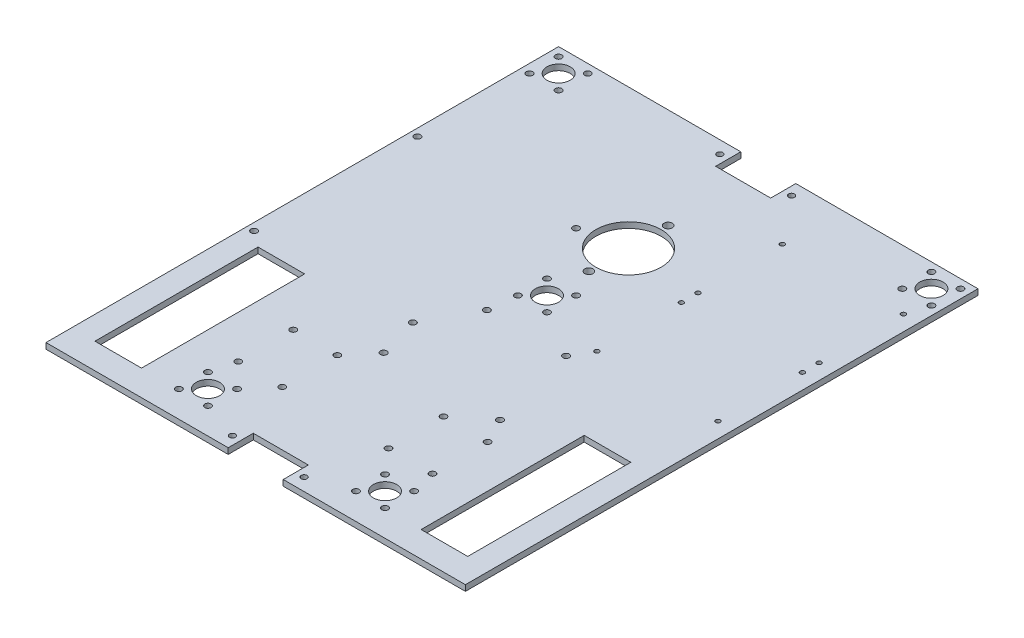
from build123d import *

# Parameters (mm, degrees)
SKETCH1_W               = 228.6
SKETCH1_H               = 279.4
BOSS_EXTRUDE1_DEPTH     = 3.175
SKETCH3_R               = 1.7
SKETCH3_W               = 25.4
SKETCH3_H               = 88.9
CUT_EXTRUDE1_DEPTH      = 362.015789994
SKETCH4_R               = 17.78
SKETCH4_R_2             = 2.25
CUT_EXTRUDE2_DEPTH      = 362.015789994
SKETCH5_R               = 1.75
CUT_EXTRUDE3_DEPTH      = 362.015789994
SKETCH6_R               = 1.25
CUT_EXTRUDE4_DEPTH      = 362.015789994
SKETCH7_R               = 1.75
CUT_EXTRUDE5_DEPTH      = 362.015789994
CUT_EXTRUDE6_DEPTH      = 362.015789994
CUT_EXTRUDE6_DEPTH_BACK = 362.015789994
SKETCH8_R               = 1.726999975
SKETCH8_R_2             = 6.35
CUT_EXTRUDE7_DEPTH      = 362.015789994
CUT_EXTRUDE7_DEPTH_BACK = 362.015789994
SKETCH9_R               = 1.599999975
SKETCH9_W               = 29.999999944
SKETCH9_H               = 13.700000032


with BuildPart() as part:
    # Sketch1 → Boss-Extrude1 (new body)
    with BuildSketch(Plane(origin=(0, 0, 0), x_dir=(1, 0, 0), z_dir=(0, 1, 0))):
        with Locations((114.3, 139.7)):
            Rectangle(SKETCH1_W, SKETCH1_H)
    extrude(amount=BOSS_EXTRUDE1_DEPTH)

    # Sketch3 → Cut-Extrude1 (cut, through all)
    with BuildSketch(Plane(origin=(0, 3.175, 0), x_dir=(1, 0, 0), z_dir=(0, 1, 0))):
        with Locations((85.34, 43.42)):
            Circle(SKETCH3_R)
        with Locations((61.34, 43.42)):
            Circle(SKETCH3_R)
        with Locations((85.34, 73.42)):
            Circle(SKETCH3_R)
        with Locations((61.34, 73.42)):
            Circle(SKETCH3_R)
        with Locations((167.26, 73.42)):
            Circle(SKETCH3_R)
        with Locations((143.26, 73.42)):
            Circle(SKETCH3_R)
        with Locations((167.26, 43.42)):
            Circle(SKETCH3_R)
        with Locations((143.26, 43.42)):
            Circle(SKETCH3_R)
        with Locations((203.2, 58.42)):
            Rectangle(SKETCH3_W, SKETCH3_H)
        with Locations((25.4, 58.42)):
            Rectangle(SKETCH3_W, SKETCH3_H)
    extrude(amount=-CUT_EXTRUDE1_DEPTH, mode=Mode.SUBTRACT)

    # Sketch4 → Cut-Extrude2 (cut, through all)
    with BuildSketch(Plane(origin=(0, 3.175, 0), x_dir=(1, 0, 0), z_dir=(0, 1, 0))):
        with Locations((114.3, 203.2)):
            Circle(SKETCH4_R)
        with Locations((114.3, 224.79)):
            Circle(SKETCH4_R_2)
        with Locations((114.3, 181.61)):
            Circle(SKETCH4_R_2)
    extrude(amount=-CUT_EXTRUDE2_DEPTH, mode=Mode.SUBTRACT)

    # Sketch5 → Cut-Extrude3 (cut, through all)
    with BuildSketch(Plane(origin=(0, 3.175, 0), x_dir=(1, 0, 0), z_dir=(0, 1, 0))):
        with Locations((90.5, 198.41)):
            Circle(SKETCH5_R)
        with Locations((90.5, 109.41)):
            Circle(SKETCH5_R)
        with Locations((4, 109.41)):
            Circle(SKETCH5_R)
        with Locations((4, 198.41)):
            Circle(SKETCH5_R)
    extrude(amount=-CUT_EXTRUDE3_DEPTH, mode=Mode.SUBTRACT)

    # Sketch6 → Cut-Extrude4 (cut, through all)
    with BuildSketch(Plane(origin=(0, 3.175, 0), x_dir=(1, 0, 0), z_dir=(0, 1, 0))):
        with Locations((154.25, 247.102093509)):
            Circle(SKETCH6_R)
        with Locations((220.25, 247.102093509)):
            Circle(SKETCH6_R)
        with Locations((220.25, 201.102093509)):
            Circle(SKETCH6_R)
        with Locations((154.25, 201.102093509)):
            Circle(SKETCH6_R)
        with Locations((220.25, 192.022093509)):
            Circle(SKETCH6_R)
        with Locations((220.25, 146.022093509)):
            Circle(SKETCH6_R)
        with Locations((154.25, 146.022093509)):
            Circle(SKETCH6_R)
        with Locations((154.25, 192.022093509)):
            Circle(SKETCH6_R)
    extrude(amount=-CUT_EXTRUDE4_DEPTH, mode=Mode.SUBTRACT)

    # Sketch7 → Cut-Extrude5 (cut, through all)
    with BuildSketch(Plane(origin=(0, 3.175, 0), x_dir=(1, 0, 0), z_dir=(0, 1, 0))):
        with Locations((104.809853043, 135.456735639)):
            Circle(SKETCH7_R)
        with Locations((148.049853043, 135.456735639)):
            Circle(SKETCH7_R)
        with Locations((96.809853043, 87.216735639)):
            Circle(SKETCH7_R)
        with Locations((160.249853043, 87.216735639)):
            Circle(SKETCH7_R)
    extrude(amount=-CUT_EXTRUDE5_DEPTH, mode=Mode.SUBTRACT)

    # Sketch8 → Cut-Extrude6 (cut, two sides: drawn at the far end of the back side and taken through both)
    with BuildSketch(Plane(origin=(0, 3.175, 0), x_dir=(1, 0, 0), z_dir=(0, 1, 0)).offset(-CUT_EXTRUDE6_DEPTH_BACK)):
        with Locations((20.63749043, 258.7625)):
            Circle(SKETCH8_R)
        with Locations((4.76249043, 258.7625)):
            Circle(SKETCH8_R)
        with Locations((4.76249043, 274.6375)):
            Circle(SKETCH8_R)
        with Locations((20.63749043, 274.6375)):
            Circle(SKETCH8_R)
        with Locations((12.69999043, 266.7)):
            Circle(SKETCH8_R_2)
        with Locations((58.10249043, 14.2875)):
            Circle(SKETCH8_R)
        with Locations((73.97749043, 14.2875)):
            Circle(SKETCH8_R)
        with Locations((66.03999043, 22.225)):
            Circle(SKETCH8_R_2)
        with Locations((58.10249043, 30.1625)):
            Circle(SKETCH8_R)
        with Locations((73.97749043, 30.1625)):
            Circle(SKETCH8_R)
        with Locations((170.49749043, 14.2875)):
            Circle(SKETCH8_R)
        with Locations((154.62249043, 14.2875)):
            Circle(SKETCH8_R)
        with Locations((154.62249043, 30.1625)):
            Circle(SKETCH8_R)
        with Locations((170.49749043, 30.1625)):
            Circle(SKETCH8_R)
        with Locations((162.55999043, 22.225)):
            Circle(SKETCH8_R_2)
        with Locations((106.36249043, 150.8125)):
            Circle(SKETCH8_R)
        with Locations((122.23749043, 150.8125)):
            Circle(SKETCH8_R)
        with Locations((114.29999043, 158.75)):
            Circle(SKETCH8_R_2)
        with Locations((106.36249043, 166.6875)):
            Circle(SKETCH8_R)
        with Locations((122.23749043, 166.6875)):
            Circle(SKETCH8_R)
        with Locations((223.83749043, 258.7625)):
            Circle(SKETCH8_R)
        with Locations((207.96249043, 258.7625)):
            Circle(SKETCH8_R)
        with Locations((207.96249043, 274.6375)):
            Circle(SKETCH8_R)
        with Locations((223.83749043, 274.6375)):
            Circle(SKETCH8_R)
        with Locations((215.89999043, 266.7)):
            Circle(SKETCH8_R_2)
    extrude(amount=CUT_EXTRUDE6_DEPTH + CUT_EXTRUDE6_DEPTH_BACK, mode=Mode.SUBTRACT)

    # Sketch9 → Cut-Extrude7 (cut, two sides: drawn at the far end of the back side and taken through both)
    with BuildSketch(Plane(origin=(0, 3.175, 0), x_dir=(1, 0, 0), z_dir=(0, 1, 0)).offset(-CUT_EXTRUDE7_DEPTH_BACK)):
        with Locations((133.850000016, 272.549999984)):
            Circle(SKETCH9_R)
        with Locations((94.749999984, 272.549999984)):
            Circle(SKETCH9_R)
        with Locations((133.850000016, 6.850000016)):
            Circle(SKETCH9_R)
        with Locations((94.749999984, 6.850000016)):
            Circle(SKETCH9_R)
        with Locations((114.3, 272.549999984)):
            Rectangle(SKETCH9_W, SKETCH9_H)
        with Locations((114.3, 6.850000016)):
            Rectangle(SKETCH9_W, SKETCH9_H)
    extrude(amount=CUT_EXTRUDE7_DEPTH + CUT_EXTRUDE7_DEPTH_BACK, mode=Mode.SUBTRACT)


solid = part.part
